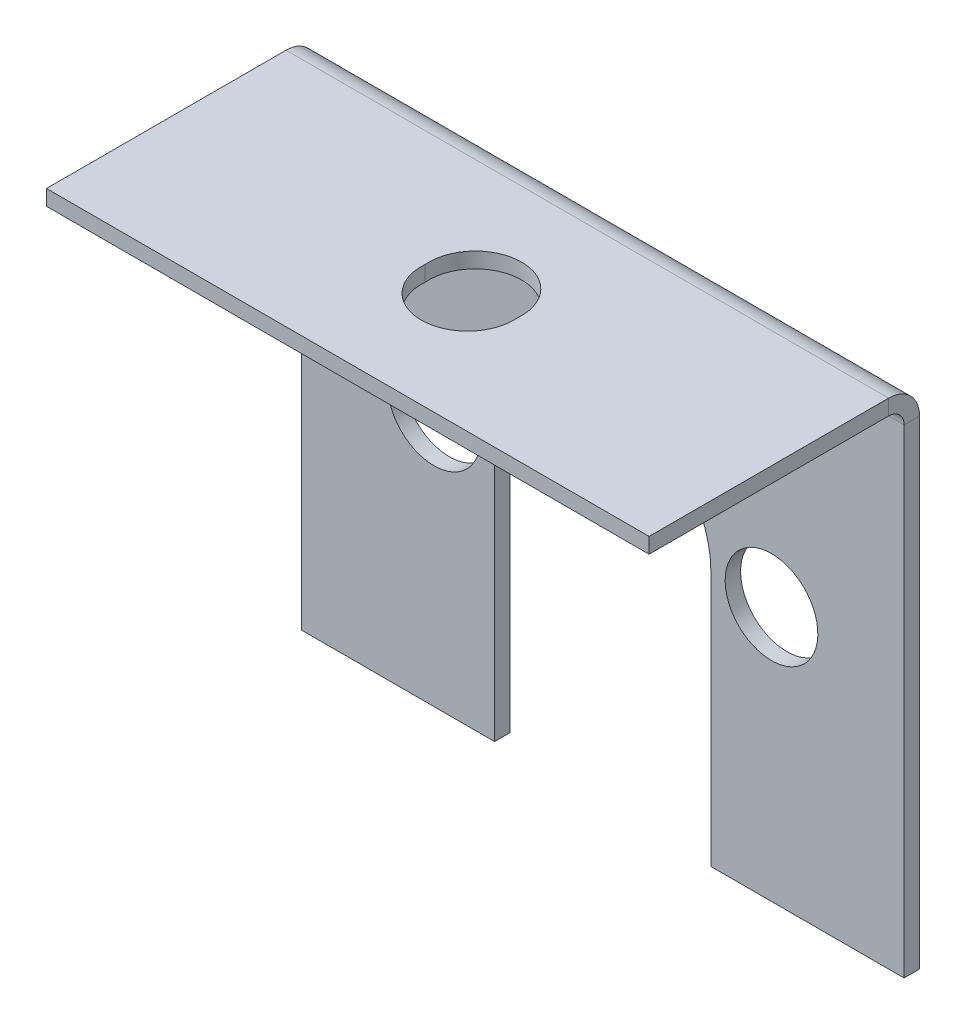
from build123d import *

# Parameters (mm, degrees)
BRIDA_BASE1_DEPTH     = 19.5
CROQUIS9_R            = 1.5
CORTAR_EXTRUIR4_DEPTH = 0.5
CROQUIS10_R           = 1.5
CORTAR_EXTRUIR5_DEPTH = 0.5
CROQUIS8_R            = 1.5
CORTAR_EXTRUIR3_DEPTH = 10


# Sheet-metal steps are written as plain solids
with BuildPart() as part:
    # Croquis1 → Brida base1 (new body)
    with BuildSketch(Plane(origin=(0, 0, 0), x_dir=(0, 0, -1), z_dir=(1, 0, 0))):
        with BuildLine():
            Line((-8.25, 24.950879865), (-0.5, 24.950879865))
            ThreePointArc((-0.5, 24.950879865), (-0.146446609, 24.804433255), (0, 24.450879865))
            Line((0, 24.450879865), (0, 8.950879865))
            Line((0, 8.950879865), (0.5, 8.950879865))
            Line((0.5, 8.950879865), (0.5, 24.450879865))
            ThreePointArc((0.5, 24.450879865), (0.207106781, 25.157986646), (-0.5, 25.450879865))
            Line((-0.5, 25.450879865), (-8.25, 25.450879865))
            Line((-8.25, 25.450879865), (-8.25, 24.950879865))
        make_face()
    extrude(amount=BRIDA_BASE1_DEPTH)

    # Croquis9 → Cortar-Extruir4 (cut)
    with BuildSketch(Plane(origin=(0, 0, -0.5), x_dir=(-1, 0, 0), z_dir=(0, 0, -1))):
        with BuildLine():
            ThreePointArc((-6.25, 17.200879865), (-9.75, 20.700879865), (-13.25, 17.200879865))
            Line((-13.25, 17.200879865), (-13.25, 8.950879865))
            Line((-13.25, 8.950879865), (-6.25, 8.950879865))
            Line((-6.25, 8.950879865), (-6.25, 17.200879865))
        make_face()
        with Locations(Location((-15.21, 17.200879865, 0), (0, 0, 90))):
            Circle(CROQUIS9_R)
        with Locations(Location((-4.29, 17.200879865, 0), (0, 0, 90))):
            Circle(CROQUIS9_R)
    extrude(amount=-CORTAR_EXTRUIR4_DEPTH, mode=Mode.SUBTRACT)

    # Croquis10 → Cortar-Extruir5 (cut)
    with BuildSketch(Plane(origin=(0, 25.450879865, 0), x_dir=(1, 0, 0), z_dir=(0, 1, 0))):
        with Locations(Location((9.75, -4.375, 0), (0, 0, 270))):
            Circle(CROQUIS10_R)
    extrude(amount=-CORTAR_EXTRUIR5_DEPTH, mode=Mode.SUBTRACT)

    # Croquis8 → Cortar-Extruir3 (cut)
    with BuildSketch(Plane(origin=(0, 25.450879865, 0), x_dir=(1, 0, 0), z_dir=(0, 1, 0))):
        with Locations((9.75, -4.125)):
            Circle(CROQUIS8_R)
    extrude(amount=-CORTAR_EXTRUIR3_DEPTH, mode=Mode.SUBTRACT)


solid = part.part
